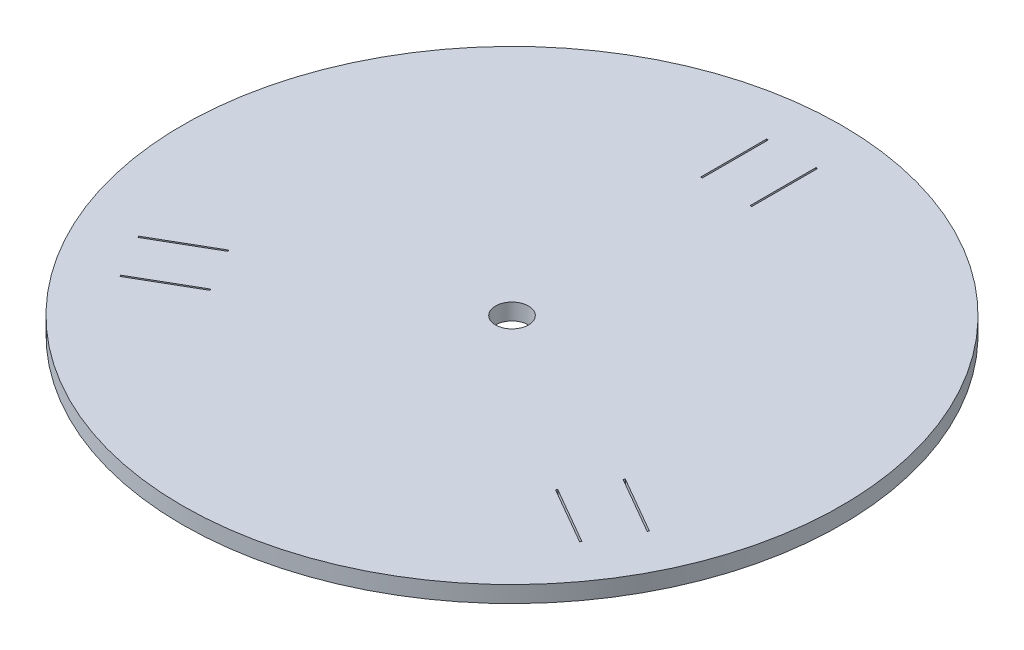
from build123d import *

# Parameters (mm, degrees)
SKETCH2_R           = 100
BOSS_EXTRUDE1_DEPTH = 5
SKETCH3_W           = 0.5
SKETCH3_H           = 20
CUT_EXTRUDE1_DEPTH  = 142.509716981


with BuildPart() as part:
    # Sketch2 → Boss-Extrude1 (new body)
    with BuildSketch(Plane(origin=(0, 0, 0), x_dir=(1, 0, 0), z_dir=(0, 1, 0))):
        Circle(SKETCH2_R)
    extrude(amount=BOSS_EXTRUDE1_DEPTH)

    # Sketch3 → Cut-Extrude1 (cut, through all)
    with BuildSketch(Plane(origin=(0, 5, 0), x_dir=(1, 0, 0), z_dir=(0, 1, 0))):
        with Locations((-7.5, 75)):
            Rectangle(SKETCH3_W, SKETCH3_H)
        with Locations((7.5, 75)):
            Rectangle(SKETCH3_W, SKETCH3_H)
        Polygon((60.166651246, -25.788303121), (77.487159322, -35.788303121), (77.237159322, -36.221315823), (59.916651246, -26.221315823), align=None)
        Polygon((52.666651246, -38.778684177), (69.987159322, -48.778684177), (69.737159322, -49.211696879), (52.416651246, -39.211696879), align=None)
        Polygon((-52.416651246, -39.211696879), (-69.737159322, -49.211696879), (-69.987159322, -48.778684177), (-52.666651246, -38.778684177), align=None)
        Polygon((-59.916651246, -26.221315823), (-77.237159322, -36.221315823), (-77.487159322, -35.788303121), (-60.166651246, -25.788303121), align=None)
    extrude(amount=-CUT_EXTRUDE1_DEPTH, mode=Mode.SUBTRACT)

    # Sketch7 → Ø10.0mm Dowel Hole1 (revolve, cut)
    with BuildSketch(Plane(origin=(0, 0, 0), x_dir=(0, 0, -1), z_dir=(1, 0, 0))):
        Polygon((0, 0), (0, 5), (5, 5), (5, 0.025), (5.025, 0), align=None)
    revolve(axis=Axis((0, -6.35, 0), (0, 1, 0)), mode=Mode.SUBTRACT)


solid = part.part
